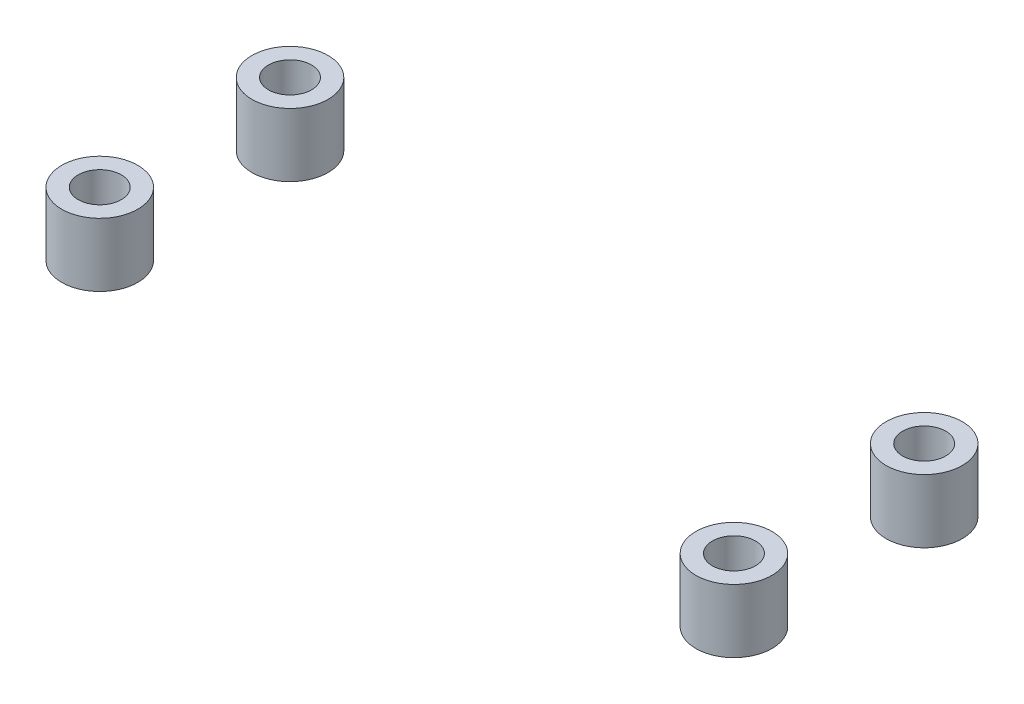
from build123d import *

# Parameters (mm, degrees)
SKETCH2_R             = 3
SKETCH2_R_2           = 1.7
BOSS_EXTRUDE1_DEPTH   = 5
BOSS_EXTRUDE1_2_DEPTH = 5
BOSS_EXTRUDE1_3_DEPTH = 5
BOSS_EXTRUDE1_4_DEPTH = 5


with BuildPart() as part:
    # Sketch2 → Boss-Extrude1 (new body)
    with BuildSketch(Plane(origin=(0, 0, 0), x_dir=(1, 0, 0), z_dir=(0, 1, 0))):
        with Locations((-25, 7.5)):
            Circle(SKETCH2_R)
        with Locations((-25, 7.5)):
            Circle(SKETCH2_R_2, mode=Mode.SUBTRACT)
    extrude(amount=BOSS_EXTRUDE1_DEPTH)


with BuildPart() as body_2:
    # Sketch2 → Boss-Extrude1 2 (new body)
    with BuildSketch(Plane(origin=(0, 0, 0), x_dir=(1, 0, 0), z_dir=(0, 1, 0))):
        with Locations((-25, -7.5)):
            Circle(SKETCH2_R)
        with Locations((-25, -7.5)):
            Circle(SKETCH2_R_2, mode=Mode.SUBTRACT)
    extrude(amount=BOSS_EXTRUDE1_2_DEPTH)


with BuildPart() as body_3:
    # Sketch2 → Boss-Extrude1 3 (new body)
    with BuildSketch(Plane(origin=(0, 0, 0), x_dir=(1, 0, 0), z_dir=(0, 1, 0))):
        with Locations((25, -7.5)):
            Circle(SKETCH2_R)
        with Locations((25, -7.5)):
            Circle(SKETCH2_R_2, mode=Mode.SUBTRACT)
    extrude(amount=BOSS_EXTRUDE1_3_DEPTH)


with BuildPart() as body_4:
    # Sketch2 → Boss-Extrude1 4 (new body)
    with BuildSketch(Plane(origin=(0, 0, 0), x_dir=(1, 0, 0), z_dir=(0, 1, 0))):
        with Locations((25, 7.5)):
            Circle(SKETCH2_R)
        with Locations((25, 7.5)):
            Circle(SKETCH2_R_2, mode=Mode.SUBTRACT)
    extrude(amount=BOSS_EXTRUDE1_4_DEPTH)


solid = Compound([part.part, body_2.part, body_3.part, body_4.part])
